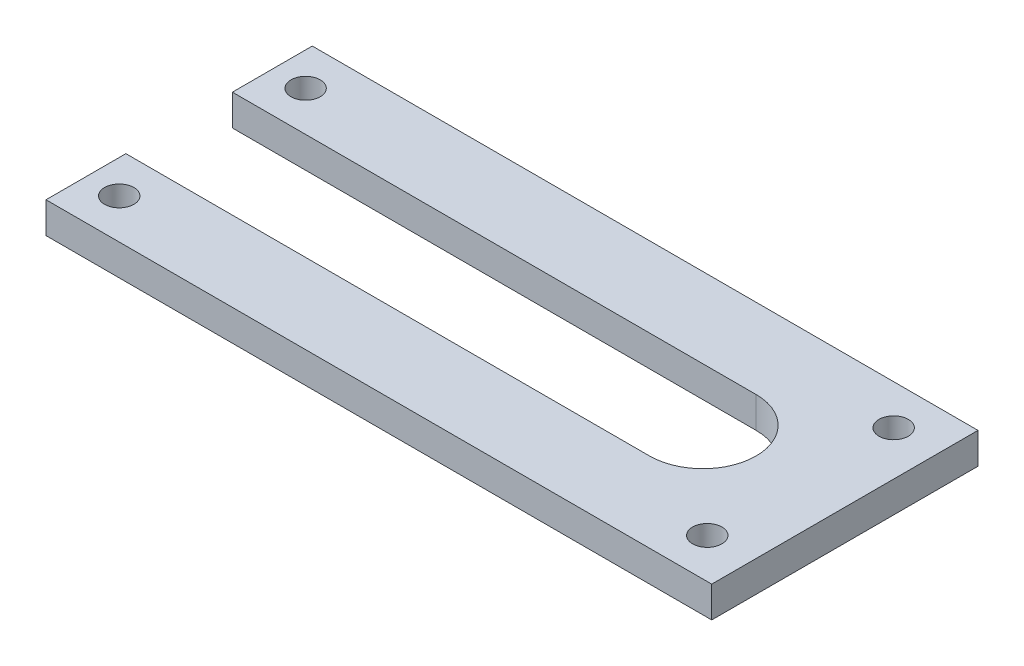
from build123d import *

# Parameters (mm, degrees)
SCHIZZO1_W                   = 150
SCHIZZO1_H                   = 7
ESTRUSIONE_ESTRUSIONE1_DEPTH = 80
SCHIZZO2_W                   = 203.570811829
SCHIZZO2_H                   = 138.674141949
SCHIZZO2_R                   = 3.3
TAGLIO_ESTRUSIONE1_DEPTH     = 171.144056611


with BuildPart() as part:
    # Schizzo1 → Estrusione-Estrusione1 (new body)
    with BuildSketch(Plane.XY):
        with Locations((75, 3.5)):
            Rectangle(SCHIZZO1_W, SCHIZZO1_H)
    extrude(amount=-ESTRUSIONE_ESTRUSIONE1_DEPTH)

    # Schizzo2 → Taglio-Estrusione1 (cut, through all)
    # profile 1 of 5: a face of its own
    with BuildSketch(Plane(origin=(0, 0, 0), x_dir=(1, 0, 0), z_dir=(0, 1, 0))):
        with Locations((73.083648688, 28.492060902)):
            Rectangle(SCHIZZO2_W, SCHIZZO2_H)
        with BuildLine():
            Line((150, 0), (0, 0))
            Line((0, 0), (0, 18))
            Line((0, 18), (118, 18))
            ThreePointArc((118, 18), (130, 30), (118, 42))
            Line((118, 42), (0, 42))
            Line((0, 42), (0, 60))
            Line((0, 60), (150, 60))
            Line((150, 60), (150, 0))
        make_face(mode=Mode.SUBTRACT)
    # profile 2 of 5: a face of its own
    with BuildSketch(Plane(origin=(0, 0, 0), x_dir=(1, 0, 0), z_dir=(0, 1, 0))):
        with Locations((140, 51)):
            Circle(SCHIZZO2_R)
    # profile 3 of 5: a face of its own
    with BuildSketch(Plane(origin=(0, 0, 0), x_dir=(1, 0, 0), z_dir=(0, 1, 0))):
        with Locations((140, 9)):
            Circle(SCHIZZO2_R)
    # profile 4 of 5: a face of its own
    with BuildSketch(Plane(origin=(0, 0, 0), x_dir=(1, 0, 0), z_dir=(0, 1, 0))):
        with Locations((7.5, 51)):
            Circle(SCHIZZO2_R)
    # profile 5 of 5: a face of its own
    with BuildSketch(Plane(origin=(0, 0, 0), x_dir=(1, 0, 0), z_dir=(0, 1, 0))):
        with Locations((7.5, 9)):
            Circle(SCHIZZO2_R)
    extrude(amount=TAGLIO_ESTRUSIONE1_DEPTH, mode=Mode.SUBTRACT)


solid = part.part
